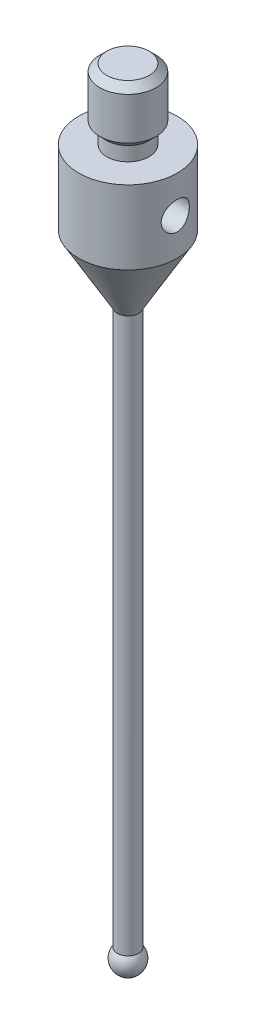
from build123d import *

# Parameters (mm, degrees)
SKETCH2_R               = 0.75
BOSS_EXTRUDE2_DEPTH     = 40
SKETCH4_R               = 3.5
BOSS_EXTRUDE3_DEPTH     = 10
CHAMFER1_SIZE           = 4.763139721
CHAMFER1_SIZE_2         = 2.75
CUT_EXTRUDE4_DEPTH      = 51.244402673
CUT_EXTRUDE4_DEPTH_BACK = 51.244402673
SKETCH5_R               = 1
SKETCH6_R               = 1.5
BOSS_EXTRUDE4_DEPTH     = 1
SKETCH7_R               = 2
BOSS_EXTRUDE5_DEPTH     = 4
CHAMFER2_SIZE           = 0.5


# Some blends are built 0.0001 mm under size
with BuildPart() as part:
    # Sketch1 → Revolve1 (revolve)
    with BuildSketch(Plane.XY):
        with BuildLine():
            Line((0, 0), (0, -1))
            ThreePointArc((0, -1), (1, 0), (0, 1))
            Line((0, 1), (0, 0))
        make_face()
    revolve(axis=Axis((0, 0, 0), (0, 1, 0)))

    # Sketch2 → Boss-Extrude2 (add)
    with BuildSketch(Plane(origin=(0, 0, 0), x_dir=(1, 0, 0), z_dir=(0, 1, 0))):
        with Locations(Location((0, 0, 0), (0, 0, 90))):
            Circle(SKETCH2_R)
    extrude(amount=BOSS_EXTRUDE2_DEPTH)

    # Sketch4 → Boss-Extrude3 (add)
    with BuildSketch(Plane(origin=(0, 40, 0), x_dir=(1, 0, 0), z_dir=(0, 1, 0))):
        with Locations(Location((0, 0, 0), (0, 0, 270))):
            Circle(SKETCH4_R)
    extrude(amount=BOSS_EXTRUDE3_DEPTH)

    # Chamfer1
    # the kernel refuses this chamfer: 4.763139721, 2.75 mm, written as the material it takes off along each edge
    with BuildSketch(Plane(origin=(0, 40, 0), x_dir=(0, 0, 1), z_dir=(-1, 0, 0))) as chamfer1_piece_1_section:
        Polygon((3.5, CHAMFER1_SIZE), (3.5 - CHAMFER1_SIZE_2, 0), (3.5, 0), align=None)
    chamfer1_piece_1 = revolve(axis=Axis((0, 40, 0), (0, 1, 0)), mode=Mode.PRIVATE)
    chamfer1_piece_1 = chamfer1_piece_1 - Plane(origin=(0, 42.439255441, 0), x_dir=(0, 0, -1), z_dir=(0, -1, 0)) * Cylinder(0.75, 20, mode=Mode.PRIVATE)
    add(chamfer1_piece_1, mode=Mode.SUBTRACT)

    # Sketch5 → Cut-Extrude4 (cut, two sides: drawn at the far end of the back side and taken through both)
    with BuildSketch(Plane(origin=(0, 0, 0), x_dir=(0, 0, -1), z_dir=(1, 0, 0)).offset(-CUT_EXTRUDE4_DEPTH_BACK)):
        with Locations((0, 47.38156986)):
            Circle(SKETCH5_R)
    extrude(amount=CUT_EXTRUDE4_DEPTH + CUT_EXTRUDE4_DEPTH_BACK, mode=Mode.SUBTRACT)

    # Sketch6 → Boss-Extrude4 (add)
    with BuildSketch(Plane(origin=(0, 50, 0), x_dir=(1, 0, 0), z_dir=(0, 1, 0))):
        with Locations(Location((0, 0, 0), (0, 0, 270))):
            Circle(SKETCH6_R)
    extrude(amount=BOSS_EXTRUDE4_DEPTH)

    # Sketch7 → Boss-Extrude5 (add)
    with BuildSketch(Plane(origin=(0, 51, 0), x_dir=(1, 0, 0), z_dir=(0, 1, 0))):
        with Locations(Location((0, 0, 0), (0, 0, 270))):
            Circle(SKETCH7_R)
    extrude(amount=BOSS_EXTRUDE5_DEPTH)

    # Chamfer2
    chamfer2_edges = [part.edges().sort_by_distance(p)[0] for p in [
        (0, 51, -2),
        (0, 55, -2),
    ]]
    chamfer(chamfer2_edges, length=CHAMFER2_SIZE - 0.0001)  # a hair under: the kernel refuses the full size


solid = part.part
